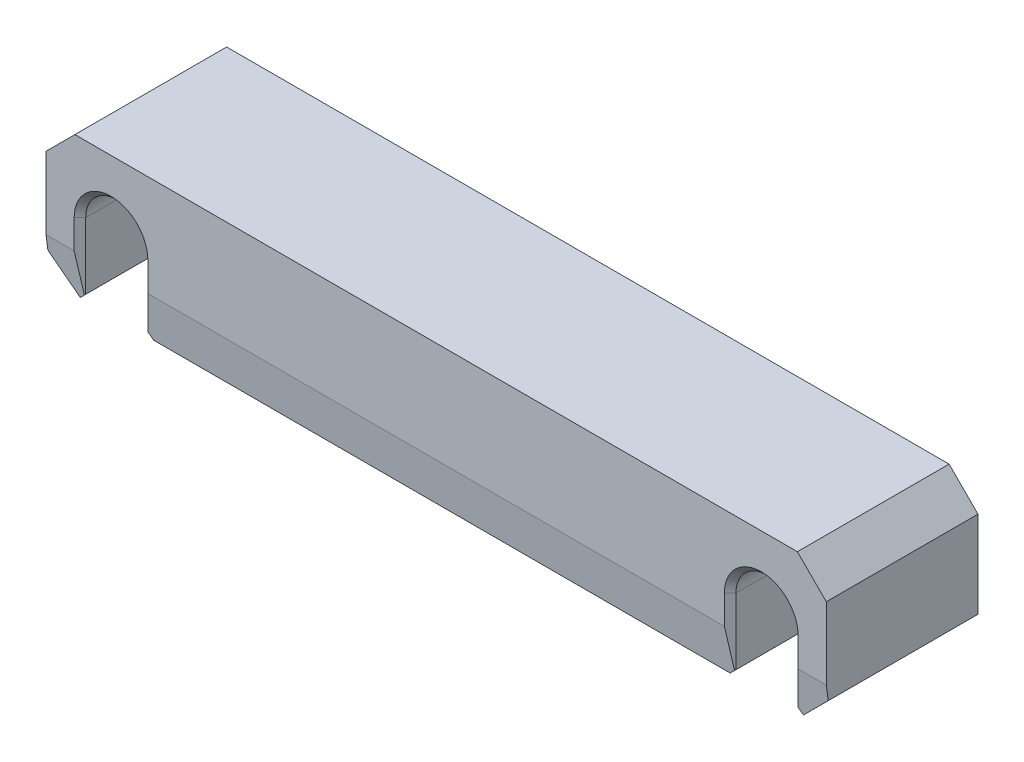
from build123d import *
from OCP.BRepFilletAPI import BRepFilletAPI_MakeChamfer

# Parameters (mm, degrees)
SKETCH1_W           = 54
SKETCH1_H           = 10
BOSS_EXTRUDE1_DEPTH = 10.5
SKETCH2_R           = 2.15
CUT_EXTRUDE1_DEPTH  = 10.5
SKETCH3_W           = 4.3
SKETCH3_H           = 5
CUT_EXTRUDE2_DEPTH  = 10.5
CHAMFER3_SIZE       = 0.4
CHAMFER3_SIZE2      = 3
CHAMFER1_SIZE       = 2
CHAMFER2_SIZE       = 0.4
CHAMFER4_SIZE       = 0.4


with BuildPart() as part:
    # Sketch1 → Boss-Extrude1 (new body)
    with BuildSketch(Plane.XY):
        with Locations((27, 5)):
            Rectangle(SKETCH1_W, SKETCH1_H)
    extrude(amount=BOSS_EXTRUDE1_DEPTH)

    # Sketch2 → Cut-Extrude1 (cut)
    with BuildSketch(Plane.XY.offset(10.5)):
        with Locations((4.5, 5)):
            Circle(SKETCH2_R)
        with Locations((49.5, 5)):
            Circle(SKETCH2_R)
    extrude(amount=-CUT_EXTRUDE1_DEPTH, mode=Mode.SUBTRACT)

    # Sketch3 → Cut-Extrude2 (cut)
    with BuildSketch(Plane.XY.offset(10.5)):
        with Locations((4.5, 2.5)):
            Rectangle(SKETCH3_W, SKETCH3_H)
        with Locations((49.5, 2.5)):
            Rectangle(SKETCH3_W, SKETCH3_H)
    extrude(amount=-CUT_EXTRUDE2_DEPTH, mode=Mode.SUBTRACT)

    # Chamfer3: one chamfer whose edges measure the first distance from different faces: ONE call of the kernel's chamfer builder (chamfer() names one face for all edges)
    chamfer3_edges_1 = [part.edges().sort_by_distance(p)[0] for p in [
        (27, 0, 10.5),
    ]]
    chamfer3_side_1 = [part.faces().sort_by_distance(p)[0] for p in [
        (27, 0, 5.25),
    ]]
    chamfer3_edges_2 = [part.edges().sort_by_distance(p)[0] for p in [
        (52.825, 0, 10.5),
    ]]
    chamfer3_side_2 = [part.faces().sort_by_distance(p)[0] for p in [
        (52.825, 0, 5.25),
    ]]
    chamfer3_edges_3 = [part.edges().sort_by_distance(p)[0] for p in [
        (1.175, 0, 10.5),
    ]]
    chamfer3_side_3 = [part.faces().sort_by_distance(p)[0] for p in [
        (1.175, 0, 5.25),
    ]]
    chamfer3 = BRepFilletAPI_MakeChamfer(part.part.solid().wrapped)
    for e in chamfer3_edges_1:
        chamfer3.Add(CHAMFER3_SIZE, CHAMFER3_SIZE2, e.wrapped, chamfer3_side_1[0].wrapped)  # the first distance lies on this face
    for e in chamfer3_edges_2:
        chamfer3.Add(CHAMFER3_SIZE, CHAMFER3_SIZE2, e.wrapped, chamfer3_side_2[0].wrapped)  # the first distance lies on this face
    for e in chamfer3_edges_3:
        chamfer3.Add(CHAMFER3_SIZE, CHAMFER3_SIZE2, e.wrapped, chamfer3_side_3[0].wrapped)  # the first distance lies on this face
    add(Compound.cast(chamfer3.Shape()), mode=Mode.REPLACE)

    # Chamfer1
    chamfer1_edges = [part.edges().sort_by_distance(p)[0] for p in [
        (0, 0, 5.05),
        (54, 0, 5.05),
        (0, 10, 5.25),
        (54, 10, 5.25),
    ]]
    chamfer(chamfer1_edges, length=CHAMFER1_SIZE)

    # Chamfer2
    chamfer2_edges = [part.edges().sort_by_distance(p)[0] for p in [
        (49.5, 7.15, 10.5),
        (49.5, 7.15, 0),
        (4.5, 7.15, 10.5),
        (4.5, 7.15, 0),
        (51.65, 2.5, 0),
        (47.35, 2.5, 0),
        (51.65, 4, 10.5),
        (47.35, 4, 10.5),
        (6.65, 2.5, 0),
        (2.35, 2.5, 0),
        (6.65, 4, 10.5),
        (2.35, 4, 10.5),
    ]]
    chamfer(chamfer2_edges, length=CHAMFER2_SIZE)

    # Chamfer4
    # the kernel refuses this chamfer: 0.4 mm, written as the material it takes off along each edge
    with BuildSketch(Plane(origin=(47.35, 0, 11.128673195), x_dir=(-0.9996219169112968, -0.02749587661058673, 0), z_dir=(0, 0, -1)), Plane(origin=(2.35, 0, 11.128673195), x_dir=(-0.9996219169112968, -0.027495876610586386, 0), z_dir=(0, 0, -1))) as chamfer4_piece_1:
        Polygon((CHAMFER4_SIZE * 0.999621916911, CHAMFER4_SIZE * 0.0274958766106), (-CHAMFER4_SIZE * 0.0274958766106, CHAMFER4_SIZE * 0.999621916911), (0, 0), align=None)
    extrude(amount=11.75734639, mode=Mode.SUBTRACT)
    with BuildSketch(Plane(origin=(6.65, 0, 11.128673195), x_dir=(0.9996219169112968, -0.027495876610586324, 0), z_dir=(0, 0, -1)), Plane(origin=(51.65, 0, 11.128673195), x_dir=(0.9996219169112968, -0.02749587661058674, 0), z_dir=(0, 0, -1))) as chamfer4_piece_2:
        Polygon((CHAMFER4_SIZE * 0.999621916911, -CHAMFER4_SIZE * 0.0274958766106), (-CHAMFER4_SIZE * 0.0274958766106, -CHAMFER4_SIZE * 0.999621916911), (0, 0), align=None)
    extrude(amount=11.75734639, mode=Mode.SUBTRACT)


solid = part.part
